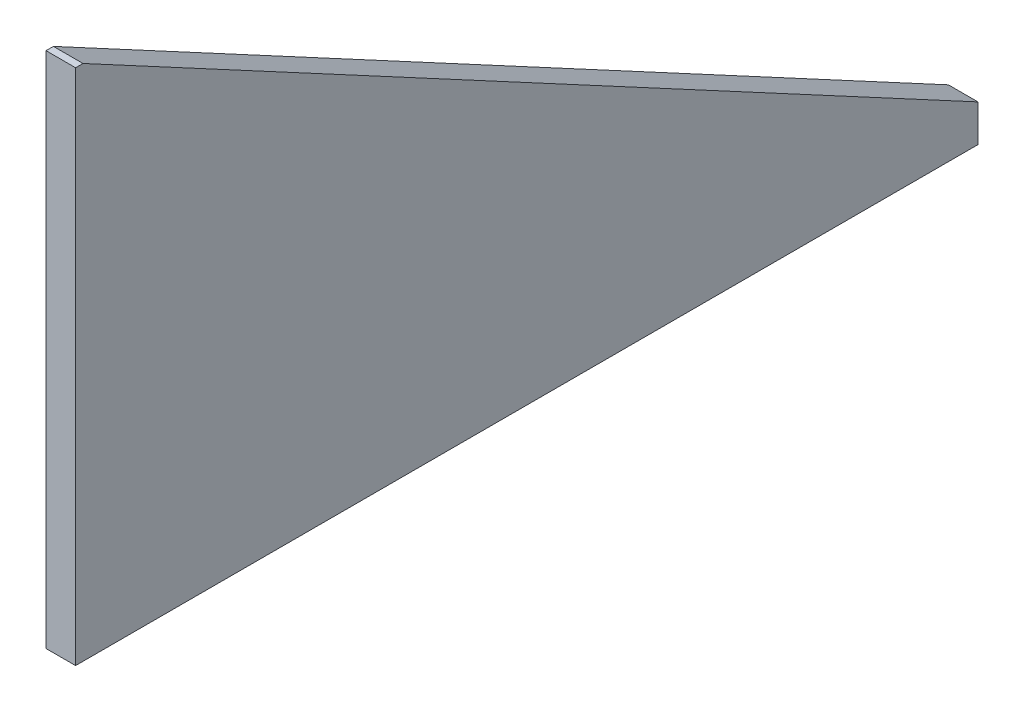
from build123d import *

# Parameters (mm, degrees)
SM_BASE_FLANGE_1_DEPTH = 16


# Sheet-metal steps are written as plain solids
with BuildPart() as part:
    # Sketch 1 → 基体-法兰1 (new body)
    with BuildSketch(Plane(origin=(0, 0, 0), x_dir=(0, 0, -1), z_dir=(1, 0, 0))):
        Polygon((0, 0), (0, 280), (4, 280), (488, 20), (488, 0), align=None)
    extrude(amount=-SM_BASE_FLANGE_1_DEPTH)


solid = part.part
